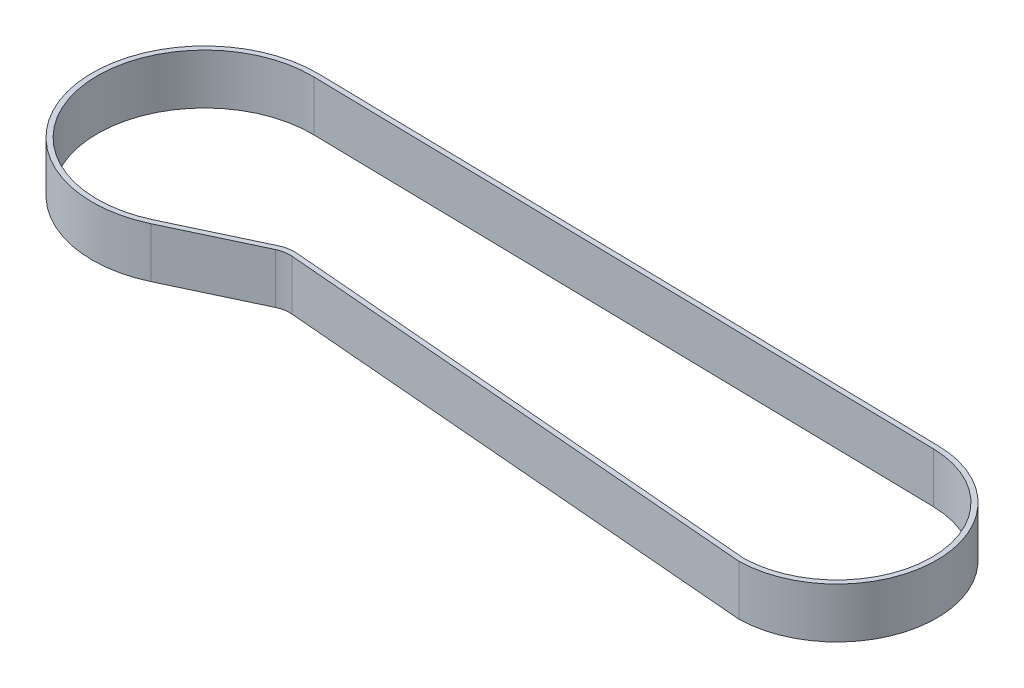
from build123d import *

# Parameters (mm, degrees)
BOSS_EXTRUDE1_DEPTH = 10


with BuildPart() as part:
    # Sketch1 → Boss-Extrude1 (new body)
    with BuildSketch(Plane(origin=(0, 0, 0), x_dir=(1, 0, 0), z_dir=(0, 1, 0))):
        with BuildLine():
            Line((0.434583333, 22.345774485), (126.386944444, 19.896237684))
            ThreePointArc((126.386944444, 19.896237684), (145.899990626, -0.019315041), (126.348320954, -19.896951337))
            Line((126.348320954, -19.896951337), (29.173318794, -11.772896043))
            ThreePointArc((29.173318794, -11.772896043), (27.738397533, -11.84119356), (26.370107503, -12.278738953))
            Line((26.370107503, -12.278738953), (9.529215368, -20.216739462))
            ThreePointArc((9.529215368, -20.216739462), (-21.856605855, -4.670254864), (0.434583333, 22.345774485))
        make_face()
        with BuildLine():
            Line((0.415138889, 21.345963546), (126.3675, 18.896426746))
            ThreePointArc((126.3675, 18.896426746), (144.899994704, -0.01414937), (126.339206206, -18.896955817))
            Line((126.339206206, -18.896955817), (29.49020734, -10.800155153))
            ThreePointArc((29.49020734, -10.800155153), (27.676529103, -10.837284179), (25.943744399, -11.374186852))
            Line((25.943744399, -11.374186852), (9.102852264, -19.312187361))
            ThreePointArc((9.102852264, -19.312187361), (-20.878681656, -4.461294915), (0.415138889, 21.345963546))
        make_face(mode=Mode.SUBTRACT)
    extrude(amount=BOSS_EXTRUDE1_DEPTH)


solid = part.part
